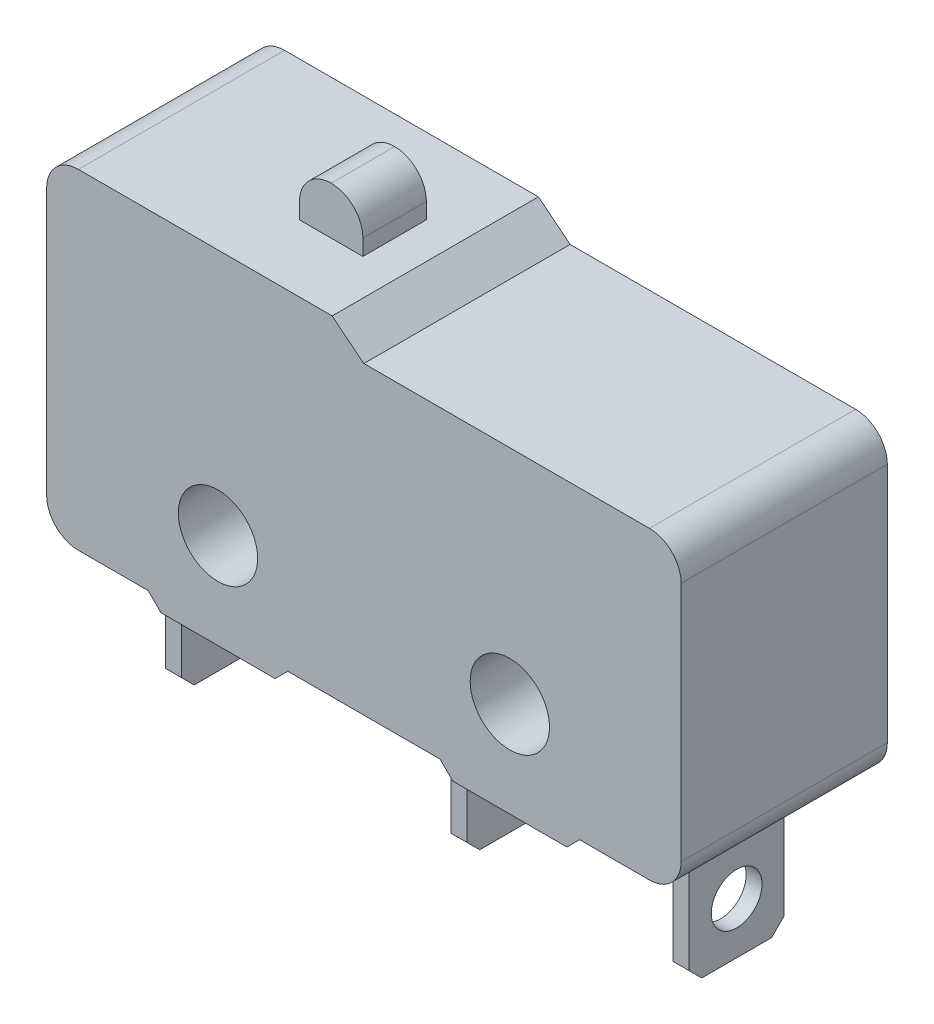
from build123d import *

# Parameters (mm, degrees)
SKETCH2_R           = 1.25
BOSS_EXTRUDE1_DEPTH = 6.5
CHAMFER1_SIZE       = 0.4
SKETCH3_W           = 2
SKETCH3_H           = 2
BOSS_EXTRUDE2_DEPTH = 1.5
FILLET1_R           = 1
BOSS_EXTRUDE3_DEPTH = 4
CHAMFER2_SIZE       = 0.4
SKETCH5_R           = 0.8
CUT_EXTRUDE2_DEPTH  = 18
BOSS_EXTRUDE4_DEPTH = 0.1


with BuildPart() as part:
    # Sketch2 → Boss-Extrude1 (new body)
    with BuildSketch(Plane.XY):
        with BuildLine():
            ThreePointArc((0, 9.8), (0.292893219, 10.507106781), (1, 10.8))
            Line((1, 10.8), (9, 10.8))
            Line((9, 10.8), (10, 10))
            Line((10, 10), (19, 10))
            ThreePointArc((19, 10), (19.707106781, 9.707106781), (20, 9))
            Line((20, 9), (20, 1.4))
            ThreePointArc((20, 1.4), (19.707106781, 0.692893219), (19, 0.4))
            Line((19, 0.4), (16.4, 0.4))
            Line((16.4, 0.4), (16.4, 0))
            Line((16.4, 0), (12.8, 0))
            Line((12.8, 0), (12.8, 0.4))
            Line((12.8, 0.4), (7.2, 0.4))
            Line((7.2, 0.4), (7.2, 0))
            Line((7.2, 0), (3.6, 0))
            Line((3.6, 0), (3.6, 0.4))
            Line((3.6, 0.4), (1, 0.4))
            ThreePointArc((1, 0.4), (0.292893219, 0.692893219), (0, 1.4))
            Line((0, 1.4), (0, 9.8))
        make_face()
        with Locations(Location((14.6, 3, 0), (0, 0, 180))):
            Circle(SKETCH2_R, mode=Mode.SUBTRACT)
        with Locations(Location((5.4, 3, 0), (0, 0, 180))):
            Circle(SKETCH2_R, mode=Mode.SUBTRACT)
    extrude(amount=BOSS_EXTRUDE1_DEPTH)

    # Chamfer1
    chamfer1_edges = [part.edges().sort_by_distance(p)[0] for p in [
        (3.6, 0.4, 3.25),
        (7.2, 0.4, 3.25),
        (12.8, 0.4, 3.25),
        (16.4, 0.4, 3.25),
    ]]
    chamfer(chamfer1_edges, length=CHAMFER1_SIZE - 0.0001)  # a hair under: the kernel refuses the full size

    # Sketch3 → Boss-Extrude2 (add)
    with BuildSketch(Plane(origin=(0, 10.8, 0), x_dir=(1, 0, 0), z_dir=(0, 1, 0))):
        with Locations((6.861600277, -3.393126413)):
            Rectangle(SKETCH3_W, SKETCH3_H)
    extrude(amount=BOSS_EXTRUDE2_DEPTH)

    # Fillet1
    fillet1_edges = [part.edges().sort_by_distance(p)[0] for p in [
        (5.861600277, 12.3, 3.393126413),
        (7.861600277, 12.3, 3.393126413),
    ]]
    fillet(fillet1_edges, radius=FILLET1_R - 0.0001)  # a hair under: the kernel refuses the full size

    # Sketch4 → Boss-Extrude3 (add)
    with BuildSketch(Plane.XZ.offset(-0.4)):
        Polygon((2, 3.25), (2, 4.75), (2.5, 4.75), (2.5, 1.75), (2.037861295, 1.75), align=None)
        Polygon((11, 3.25), (11, 4.75), (11.5, 4.75), (11.5, 1.75), (11, 1.75), align=None)
        Polygon((18, 3.25), (18, 4.75), (18.5, 4.75), (18.5, 1.75), (18, 1.75), align=None)
    extrude(amount=BOSS_EXTRUDE3_DEPTH)

    # Chamfer2
    chamfer2_edges = [part.edges().sort_by_distance(p)[0] for p in [
        (2.268930648, -3.6, 1.75),
        (2.25, -3.6, 4.75),
        (11.25, -3.6, 1.75),
        (11.25, -3.6, 4.75),
        (18.25, -3.6, 1.75),
        (18.25, -3.6, 4.75),
    ]]
    chamfer(chamfer2_edges, length=CHAMFER2_SIZE)

    # Sketch5 → Cut-Extrude2 (cut)
    with BuildSketch(Plane(origin=(18.5, 0, 0), x_dir=(0, 0, -1), z_dir=(1, 0, 0))):
        with Locations(Location((-3.25, -1.983091363, 0), (0, 0, 90))):
            Circle(SKETCH5_R)
    extrude(amount=-CUT_EXTRUDE2_DEPTH, mode=Mode.SUBTRACT)

    # Sketch6 → Boss-Extrude4 (add)
    # profile 1 of 8: a face of its own
    with BuildSketch(Plane(origin=(0, 0, 0), x_dir=(-1, 0, 0), z_dir=(0, 0, -1))):
        with BuildLine():
            Line((-15.857970631, 8.152098297), (-15.857970631, 7.93500428))
            Line((-15.857970631, 7.93500428), (-16.577942586, 7.93500428))
            Line((-16.577942586, 7.93500428), (-16.692001747, 7.37827685))
            add(Edge.make_bspline(
                [(-16.692001747, 7.37827685), (-16.669591766, 7.384463728), (-16.626175972, 7.396449827), (-16.562095485, 7.409758079), (-16.501261152, 7.417780514), (-16.461785095, 7.418875926), (-16.442682837, 7.41940599)],
                knots=[0, 0, 0, 0, 1.100273476, 2.13160584, 3.095893838, 4, 4, 4, 4], degree=3))
            add(Edge.make_bspline(
                [(-16.442682837, 7.41940599), (-16.41904648, 7.4188944), (-16.372571497, 7.417888487), (-16.304572705, 7.408229321), (-16.23966186, 7.393025658), (-16.177974713, 7.371786105), (-16.119397141, 7.344626409), (-16.064468092, 7.310699302), (-16.012363069, 7.27106724), (-15.964016833, 7.225501447), (-15.920156895, 7.175353612), (-15.881593653, 7.121434328), (-15.848838182, 7.064267599), (-15.822494297, 7.003307231), (-15.801458057, 6.939227171), (-15.787456612, 6.871353181), (-15.778133174, 6.800325032), (-15.77709154, 6.751759888), (-15.776560374, 6.726994799)],
                knots=[0, 0, 0, 0, 1.052922333, 2.070308379, 3.05430497, 4.020497103, 4.973039431, 5.925935799, 6.892292201, 7.88610001, 8.88166317, 9.857072816, 10.836096531, 11.812156883, 12.81219415, 13.836441305, 14.89672472, 16, 16, 16, 16], degree=3))
            add(Edge.make_bspline(
                [(-15.776560374, 6.726994799), (-15.776962587, 6.709745646), (-15.777761575, 6.675480449), (-15.781824721, 6.624593242), (-15.78964775, 6.574783338), (-15.800151087, 6.52604413), (-15.813783883, 6.47846789), (-15.830287263, 6.431918442), (-15.850483908, 6.386685514), (-15.872637169, 6.342341108), (-15.897581467, 6.299887725), (-15.925266565, 6.260185719), (-15.954516171, 6.222639511), (-15.985988819, 6.187651777), (-16.01997704, 6.155452428), (-16.05606921, 6.125850372), (-16.093977331, 6.098344996), (-16.134287882, 6.074052802), (-16.176102622, 6.051699014), (-16.2200254, 6.033360494), (-16.265056396, 6.016965079), (-16.311843725, 6.00389646), (-16.360281412, 5.993656296), (-16.4104493, 5.986701171), (-16.462084276, 5.981635421), (-16.497084879, 5.98131831), (-16.514764835, 5.981158127)],
                knots=[0, 0, 0, 0, 1.056347294, 2.098418968, 3.122841568, 4.141288669, 5.149314143, 6.15115421, 7.162517403, 8.180376062, 9.185164535, 10.17417709, 11.141909838, 12.097768115, 13.052685741, 14.0056014, 14.954263652, 15.917497458, 16.885230207, 17.854509472, 18.828990115, 19.81800267, 20.826176721, 21.857883937, 22.917946725, 24, 24, 24, 24], degree=3))
            add(Edge.make_bspline(
                [(-16.514764835, 5.981158127), (-16.535855411, 5.981575919), (-16.577348627, 5.982397876), (-16.638139637, 5.990996675), (-16.696628946, 6.003311995), (-16.752345722, 6.021839644), (-16.805789295, 6.045054818), (-16.856240177, 6.07439555), (-16.90498748, 6.107644818), (-16.950049521, 6.146881983), (-16.991872504, 6.189769086), (-17.029311202, 6.236310136), (-17.062653889, 6.285736989), (-17.091366622, 6.338289682), (-17.115858282, 6.393830127), (-17.135098775, 6.452566418), (-17.150628066, 6.514191659), (-17.157197849, 6.556617829), (-17.160534733, 6.578166674)],
                knots=[0, 0, 0, 0, 1.0467383, 2.05933395, 3.04377827, 4.011590433, 4.970194871, 5.932262533, 6.905835911, 7.896367577, 8.894135286, 9.877477877, 10.858688626, 11.851381753, 12.8477658, 13.868841284, 14.917554742, 16, 16, 16, 16], degree=3))
            Line((-17.160534733, 6.578166674), (-16.970577468, 6.578166674))
            add(Edge.make_bspline(
                [(-16.970577468, 6.578166674), (-16.965903531, 6.557981867), (-16.956919965, 6.519185547), (-16.93720125, 6.464677545), (-16.913091887, 6.416103538), (-16.884423543, 6.372820981), (-16.850224239, 6.335078397), (-16.811199299, 6.301443317), (-16.767446152, 6.27109931), (-16.718827389, 6.245806493), (-16.66753567, 6.22423539), (-16.613852643, 6.20987127), (-16.559240014, 6.199771206), (-16.522302143, 6.198760189), (-16.503740529, 6.198252144)],
                knots=[0, 0, 0, 0, 1.136247022, 2.183929868, 3.172523383, 4.106158343, 5.02341133, 5.958108904, 6.928429099, 7.938127109, 8.96079061, 9.975095812, 10.982467395, 12, 12, 12, 12], degree=3))
            add(Edge.make_bspline(
                [(-16.503740529, 6.198252144), (-16.485622803, 6.198748519), (-16.449948853, 6.199725886), (-16.397448633, 6.207248526), (-16.3467618, 6.218834296), (-16.298388494, 6.236172732), (-16.251482229, 6.25724549), (-16.20722952, 6.284287464), (-16.164350161, 6.315408523), (-16.124176957, 6.351063247), (-16.087383576, 6.390354443), (-16.054873921, 6.432371724), (-16.02779455, 6.477194769), (-16.004974398, 6.524047581), (-15.987645975, 6.573443661), (-15.975284048, 6.625151514), (-15.968025055, 6.679298859), (-15.967026485, 6.716231252), (-15.966517639, 6.735051022)],
                knots=[0, 0, 0, 0, 1.027316725, 2.022795036, 3.002884548, 3.971462791, 4.93288096, 5.914575861, 6.907176829, 7.935150275, 8.956128384, 9.956726525, 10.942570165, 11.921478529, 12.907843606, 13.90538589, 14.932640048, 16, 16, 16, 16], degree=3))
            add(Edge.make_bspline(
                [(-15.966517639, 6.735051022), (-15.966915863, 6.752030167), (-15.967695328, 6.785264427), (-15.974063816, 6.833886805), (-15.985141223, 6.879892883), (-16.000516617, 6.923504824), (-16.020038034, 6.964763763), (-16.043893661, 7.00371228), (-16.072531192, 7.039837027), (-16.105243905, 7.073154905), (-16.141080911, 7.103903948), (-16.180658793, 7.1301168), (-16.223149321, 7.152168789), (-16.268040554, 7.171199435), (-16.316400279, 7.184867505), (-16.367270814, 7.195129036), (-16.421201489, 7.201064993), (-16.458074239, 7.201888612), (-16.477027789, 7.202311973)],
                knots=[0, 0, 0, 0, 1.045622112, 2.046656509, 3.013763289, 3.955457236, 4.890082067, 5.820317437, 6.762574623, 7.722996705, 8.69280354, 9.665887285, 10.63943826, 11.638615906, 12.663482002, 13.728887084, 14.832589034, 16, 16, 16, 16], degree=3))
            add(Edge.make_bspline(
                [(-16.477027789, 7.202311973), (-16.493434332, 7.201960853), (-16.52730968, 7.201235881), (-16.579272532, 7.195897952), (-16.633877527, 7.187286569), (-16.69091534, 7.175441553), (-16.750557267, 7.159940854), (-16.812677442, 7.141365894), (-16.87740648, 7.119157828), (-16.921020532, 7.102386442), (-16.943440716, 7.093764964)],
                knots=[0, 0, 0, 0, 0.817624296, 1.688186739, 2.600797293, 3.572016777, 4.590301741, 5.671205678, 6.80286297, 8, 8, 8, 8], degree=3))
            Line((-16.943440716, 7.093764964), (-16.726346699, 8.152098297))
            Line((-16.726346699, 8.152098297), (-15.857970631, 8.152098297))
        make_face()
    # profile 2 of 8: a face of its own
    with BuildSketch(Plane(origin=(0, 0, 0), x_dir=(-1, 0, 0), z_dir=(0, 0, -1))):
        Polygon((-14.501133024, 8.152098297), (-13.524209947, 6.035431631), (-13.73070367, 6.035431631), (-14.043624343, 6.713850434), (-15.003162938, 6.713850434), (-15.324987858, 6.035431631), (-15.532329605, 6.035431631), (-14.528269776, 8.152098297), align=None)
        Polygon((-14.516821459, 7.739534863), (-14.900128083, 6.930944451), (-14.143691117, 6.930944451), align=None, mode=Mode.SUBTRACT)
    # profile 3 of 8: a face of its own
    with BuildSketch(Plane(origin=(0, 0, 0), x_dir=(-1, 0, 0), z_dir=(0, 0, -1))):
        with BuildLine():
            Line((-13.062885161, 7.500816246), (-13.252842426, 7.500816246))
            add(Edge.make_bspline(
                [(-13.252842426, 7.500816246), (-13.251604385, 7.526017212), (-13.249172908, 7.575511237), (-13.237786276, 7.64767379), (-13.221493459, 7.716649787), (-13.198457199, 7.781885402), (-13.169848164, 7.843957443), (-13.135540005, 7.902619357), (-13.094903724, 7.957647361), (-13.048816794, 8.008531329), (-12.998761474, 8.055211431), (-12.944752644, 8.095521982), (-12.887998747, 8.129580765), (-12.828671968, 8.158053706), (-12.76610296, 8.179425899), (-12.700859517, 8.195283747), (-12.632654992, 8.20482468), (-12.586185074, 8.205850227), (-12.562551293, 8.206371802)],
                knots=[0, 0, 0, 0, 1.10065271, 2.161652631, 3.183658789, 4.190468796, 5.17591951, 6.163126047, 7.15150782, 8.156236427, 9.156009102, 10.134482811, 11.092018607, 12.041330605, 13.001268258, 13.972401359, 14.968799086, 16, 16, 16, 16], degree=3))
            add(Edge.make_bspline(
                [(-12.562551293, 8.206371802), (-12.539341696, 8.205828449), (-12.493735667, 8.204760782), (-12.427174353, 8.195591969), (-12.363809037, 8.18123154), (-12.303763578, 8.161083645), (-12.247517053, 8.133999729), (-12.194646926, 8.101465027), (-12.144523769, 8.063836844), (-12.099404429, 8.019535728), (-12.057973352, 7.972241905), (-12.02223056, 7.921751601), (-11.991621647, 7.869603414), (-11.966108145, 7.815399692), (-11.947326575, 7.75863007), (-11.933067373, 7.700121048), (-11.925007461, 7.639266995), (-11.923770467, 7.598078745), (-11.923141571, 7.577138362)],
                knots=[0, 0, 0, 0, 1.111607364, 2.184268762, 3.212621178, 4.221274766, 5.211760367, 6.196651075, 7.1921475, 8.207485113, 9.220403448, 10.201281604, 11.166441695, 12.114753415, 13.065576456, 14.026450734, 14.996634279, 16, 16, 16, 16], degree=3))
            add(Edge.make_bspline(
                [(-11.923141571, 7.577138362), (-11.924165592, 7.547657528), (-11.926195663, 7.489213209), (-11.943561025, 7.40332803), (-11.970682486, 7.320116771), (-12.00333803, 7.25314707), (-12.036280889, 7.199182052), (-12.065967144, 7.154750978), (-12.100719673, 7.106911004), (-12.141044288, 7.055822329), (-12.186106834, 7.001084782), (-12.236315476, 6.942731429), (-12.292028249, 6.881365168), (-12.331131247, 6.839451781), (-12.351393441, 6.817733313)],
                knots=[0, 0, 0, 0, 1.184426356, 2.348067706, 3.509069118, 4.696110526, 5.333549288, 6.050745305, 6.844228056, 7.710549037, 8.667450064, 9.695053472, 10.805634456, 12, 12, 12, 12], degree=3))
            Line((-12.351393441, 6.817733313), (-12.880984119, 6.252525648))
            Line((-12.880984119, 6.252525648), (-11.896004819, 6.252525648))
            Line((-11.896004819, 6.252525648), (-11.896004819, 6.035431631))
            Line((-11.896004819, 6.035431631), (-13.334252682, 6.035431631))
            Line((-13.334252682, 6.035431631), (-12.51336593, 6.911439911))
            add(Edge.make_bspline(
                [(-12.51336593, 6.911439911), (-12.493379827, 6.932303172), (-12.454990613, 6.972377228), (-12.400693531, 7.030883685), (-12.351926143, 7.085160788), (-12.308372767, 7.135105986), (-12.270978219, 7.181449839), (-12.237793583, 7.222691398), (-12.211204869, 7.260642899), (-12.182348415, 7.304633651), (-12.15439996, 7.358343957), (-12.13038344, 7.423980998), (-12.115739222, 7.491549384), (-12.113982488, 7.53721014), (-12.113098836, 7.560177891)],
                knots=[0, 0, 0, 0, 1.329631726, 2.553950428, 3.673215718, 4.687767853, 5.603093632, 6.413772471, 7.123043292, 7.734684054, 8.834405432, 9.900288307, 10.943827018, 12, 12, 12, 12], degree=3))
            add(Edge.make_bspline(
                [(-12.113098836, 7.560177891), (-12.113483309, 7.574620451), (-12.114241031, 7.603083964), (-12.120928305, 7.644816018), (-12.131034182, 7.685071882), (-12.145515362, 7.72397538), (-12.164629914, 7.761135369), (-12.187897149, 7.796597084), (-12.214742568, 7.83088041), (-12.24579786, 7.8630255), (-12.279913398, 7.892466039), (-12.31595373, 7.918545843), (-12.354084031, 7.940340924), (-12.394143533, 7.958207706), (-12.436020555, 7.972223293), (-12.479796092, 7.98193491), (-12.525349187, 7.988032413), (-12.556454206, 7.988857412), (-12.572303563, 7.989277785)],
                knots=[0, 0, 0, 0, 0.991446411, 1.95395049, 2.89581595, 3.838931463, 4.798493298, 5.75982156, 6.748411868, 7.785213223, 8.824556874, 9.840280684, 10.836137867, 11.835679398, 12.848801643, 13.863922112, 14.911575587, 16, 16, 16, 16], degree=3))
            add(Edge.make_bspline(
                [(-12.572303563, 7.989277785), (-12.5888564, 7.98884536), (-12.621363439, 7.98799615), (-12.669090664, 7.982055777), (-12.714620634, 7.971807579), (-12.75806788, 7.957791209), (-12.799505915, 7.939975801), (-12.838733218, 7.917786032), (-12.875661727, 7.891307443), (-12.910360863, 7.861286725), (-12.942330984, 7.827862986), (-12.970420285, 7.790603627), (-12.99496395, 7.750188952), (-13.016378106, 7.70672801), (-13.033768452, 7.659826438), (-13.047056976, 7.609650731), (-13.057571879, 7.556418752), (-13.061084651, 7.519658249), (-13.062885161, 7.500816246)],
                knots=[0, 0, 0, 0, 1.031018746, 2.02475058, 2.990194455, 3.934040569, 4.864654155, 5.795059489, 6.735614925, 7.690564532, 8.649604399, 9.611025574, 10.590972636, 11.591080095, 12.624614302, 13.701020113, 14.821632451, 16, 16, 16, 16], degree=3))
        make_face()
    # profile 4 of 8: a face of its own
    with BuildSketch(Plane(origin=(0, 0, 0), x_dir=(-1, 0, 0), z_dir=(0, 0, -1))):
        with BuildLine():
            Line((-10.376346699, 8.152098297), (-10.376346699, 7.93500428))
            Line((-10.376346699, 7.93500428), (-11.096318654, 7.93500428))
            Line((-11.096318654, 7.93500428), (-11.210377816, 7.37827685))
            add(Edge.make_bspline(
                [(-11.210377816, 7.37827685), (-11.187967834, 7.384463728), (-11.14455204, 7.396449827), (-11.080471553, 7.409758079), (-11.01963722, 7.417780514), (-10.980161163, 7.418875926), (-10.961058905, 7.41940599)],
                knots=[0, 0, 0, 0, 1.100273476, 2.13160584, 3.095893838, 4, 4, 4, 4], degree=3))
            add(Edge.make_bspline(
                [(-10.961058905, 7.41940599), (-10.937422548, 7.4188944), (-10.890947565, 7.417888487), (-10.822948774, 7.408229321), (-10.758037929, 7.393025658), (-10.696350781, 7.371786105), (-10.63777321, 7.344626409), (-10.582844161, 7.310699302), (-10.530739137, 7.27106724), (-10.482392902, 7.225501447), (-10.438532963, 7.175353612), (-10.399969722, 7.121434328), (-10.36721425, 7.064267599), (-10.340870365, 7.003307231), (-10.319834125, 6.939227171), (-10.305832681, 6.871353181), (-10.296509242, 6.800325032), (-10.295467609, 6.751759888), (-10.294936443, 6.726994799)],
                knots=[0, 0, 0, 0, 1.052922333, 2.070308379, 3.05430497, 4.020497103, 4.973039431, 5.925935799, 6.892292201, 7.88610001, 8.88166317, 9.857072816, 10.836096531, 11.812156883, 12.81219415, 13.836441305, 14.89672472, 16, 16, 16, 16], degree=3))
            add(Edge.make_bspline(
                [(-10.294936443, 6.726994799), (-10.295338655, 6.709745646), (-10.296137644, 6.675480449), (-10.30020079, 6.624593242), (-10.308023818, 6.574783338), (-10.318527156, 6.52604413), (-10.332159951, 6.47846789), (-10.348663332, 6.431918442), (-10.368859977, 6.386685514), (-10.391013237, 6.342341108), (-10.415957536, 6.299887725), (-10.443642633, 6.260185719), (-10.47289224, 6.222639511), (-10.504364887, 6.187651777), (-10.538353108, 6.155452428), (-10.574445278, 6.125850372), (-10.612353399, 6.098344996), (-10.65266395, 6.074052802), (-10.69447869, 6.051699014), (-10.738401469, 6.033360494), (-10.783432464, 6.016965079), (-10.830219793, 6.00389646), (-10.87865748, 5.993656296), (-10.928825368, 5.986701171), (-10.980460345, 5.981635421), (-11.015460948, 5.98131831), (-11.033140903, 5.981158127)],
                knots=[0, 0, 0, 0, 1.056347294, 2.098418968, 3.122841568, 4.141288669, 5.149314143, 6.15115421, 7.162517403, 8.180376062, 9.185164535, 10.17417709, 11.141909838, 12.097768115, 13.052685741, 14.0056014, 14.954263652, 15.917497458, 16.885230207, 17.854509472, 18.828990115, 19.81800267, 20.826176721, 21.857883937, 22.917946725, 24, 24, 24, 24], degree=3))
            add(Edge.make_bspline(
                [(-11.033140903, 5.981158127), (-11.054231479, 5.981575919), (-11.095724696, 5.982397876), (-11.156515705, 5.990996675), (-11.215005015, 6.003311995), (-11.27072179, 6.021839644), (-11.324165364, 6.045054818), (-11.374616246, 6.07439555), (-11.423363548, 6.107644818), (-11.468425589, 6.146881983), (-11.510248572, 6.189769086), (-11.547687271, 6.236310136), (-11.581029957, 6.285736989), (-11.60974269, 6.338289682), (-11.634234351, 6.393830127), (-11.653474844, 6.452566418), (-11.669004134, 6.514191659), (-11.675573917, 6.556617829), (-11.678910802, 6.578166674)],
                knots=[0, 0, 0, 0, 1.0467383, 2.05933395, 3.04377827, 4.011590433, 4.970194871, 5.932262533, 6.905835911, 7.896367577, 8.894135286, 9.877477877, 10.858688626, 11.851381753, 12.8477658, 13.868841284, 14.917554742, 16, 16, 16, 16], degree=3))
            Line((-11.678910802, 6.578166674), (-11.488953537, 6.578166674))
            add(Edge.make_bspline(
                [(-11.488953537, 6.578166674), (-11.4842796, 6.557981867), (-11.475296033, 6.519185547), (-11.455577318, 6.464677545), (-11.431467956, 6.416103538), (-11.402799612, 6.372820981), (-11.368600307, 6.335078397), (-11.329575367, 6.301443317), (-11.28582222, 6.27109931), (-11.237203458, 6.245806493), (-11.185911738, 6.22423539), (-11.132228711, 6.20987127), (-11.077616083, 6.199771206), (-11.040678211, 6.198760189), (-11.022116598, 6.198252144)],
                knots=[0, 0, 0, 0, 1.136247022, 2.183929868, 3.172523383, 4.106158343, 5.02341133, 5.958108904, 6.928429099, 7.938127109, 8.96079061, 9.975095812, 10.982467395, 12, 12, 12, 12], degree=3))
            add(Edge.make_bspline(
                [(-11.022116598, 6.198252144), (-11.003998872, 6.198748519), (-10.968324921, 6.199725886), (-10.915824702, 6.207248526), (-10.865137868, 6.218834296), (-10.816764562, 6.236172732), (-10.769858298, 6.25724549), (-10.725605589, 6.284287464), (-10.68272623, 6.315408523), (-10.642553025, 6.351063247), (-10.605759644, 6.390354443), (-10.57324999, 6.432371724), (-10.546170618, 6.477194769), (-10.523350467, 6.524047581), (-10.506022043, 6.573443661), (-10.493660116, 6.625151514), (-10.486401124, 6.679298859), (-10.485402553, 6.716231252), (-10.484893708, 6.735051022)],
                knots=[0, 0, 0, 0, 1.027316725, 2.022795036, 3.002884548, 3.971462791, 4.93288096, 5.914575861, 6.907176829, 7.935150275, 8.956128384, 9.956726525, 10.942570165, 11.921478529, 12.907843606, 13.90538589, 14.932640048, 16, 16, 16, 16], degree=3))
            add(Edge.make_bspline(
                [(-10.484893708, 6.735051022), (-10.485291931, 6.752030167), (-10.486071396, 6.785264427), (-10.492439884, 6.833886805), (-10.503517291, 6.879892883), (-10.518892685, 6.923504824), (-10.538414102, 6.964763763), (-10.562269729, 7.00371228), (-10.59090726, 7.039837027), (-10.623619974, 7.073154905), (-10.659456979, 7.103903948), (-10.699034862, 7.1301168), (-10.741525389, 7.152168789), (-10.786416623, 7.171199435), (-10.834776347, 7.184867505), (-10.885646882, 7.195129036), (-10.939577558, 7.201064993), (-10.976450307, 7.201888612), (-10.995403857, 7.202311973)],
                knots=[0, 0, 0, 0, 1.045622112, 2.046656509, 3.013763289, 3.955457236, 4.890082067, 5.820317437, 6.762574623, 7.722996705, 8.69280354, 9.665887285, 10.63943826, 11.638615906, 12.663482002, 13.728887084, 14.832589034, 16, 16, 16, 16], degree=3))
            add(Edge.make_bspline(
                [(-10.995403857, 7.202311973), (-11.0118104, 7.201960853), (-11.045685748, 7.201235881), (-11.097648601, 7.195897952), (-11.152253595, 7.187286569), (-11.209291409, 7.175441553), (-11.268933335, 7.159940854), (-11.331053511, 7.141365894), (-11.395782548, 7.119157828), (-11.439396601, 7.102386442), (-11.461816785, 7.093764964)],
                knots=[0, 0, 0, 0, 0.817624296, 1.688186739, 2.600797293, 3.572016777, 4.590301741, 5.671205678, 6.80286297, 8, 8, 8, 8], degree=3))
            Line((-11.461816785, 7.093764964), (-11.244722768, 8.152098297))
            Line((-11.244722768, 8.152098297), (-10.376346699, 8.152098297))
        make_face()
    # profile 5 of 8: a face of its own
    with BuildSketch(Plane(origin=(0, 0, 0), x_dir=(-1, 0, 0), z_dir=(0, 0, -1))):
        with BuildLine():
            add(Edge.make_bspline(
                [(-10.077842426, 7.092916941), (-10.077644053, 7.126842504), (-10.077258711, 7.192743399), (-10.072971904, 7.288770301), (-10.065850625, 7.37885581), (-10.056091357, 7.463004235), (-10.044215055, 7.541237302), (-10.028360927, 7.613345941), (-10.01033128, 7.679663894), (-9.989435277, 7.740407418), (-9.965856947, 7.796394886), (-9.940194323, 7.848661556), (-9.911428947, 7.897128343), (-9.881204814, 7.942568817), (-9.848298466, 7.984239146), (-9.81364634, 8.022727804), (-9.775895968, 8.057145258), (-9.736330624, 8.088499927), (-9.694592096, 8.115986036), (-9.651870103, 8.140196311), (-9.607870586, 8.160879088), (-9.562473418, 8.177141399), (-9.516086633, 8.190573673), (-9.468548074, 8.19975937), (-9.419779249, 8.205539024), (-9.386861191, 8.206091575), (-9.370166811, 8.206371802)],
                knots=[0, 0, 0, 0, 1.646270934, 3.197905019, 4.663502075, 6.030701355, 7.308322542, 8.50163776, 9.611534131, 10.641858119, 11.616356847, 12.558055219, 13.465016945, 14.349605745, 15.204443733, 16.039544428, 16.859896111, 17.680448484, 18.487036065, 19.28249412, 20.06191084, 20.843045899, 21.620316918, 22.403196591, 23.190181807, 24, 24, 24, 24], degree=3))
            add(Edge.make_bspline(
                [(-9.370166811, 8.206371802), (-9.353332974, 8.20607679), (-9.319855769, 8.205490104), (-9.270361828, 8.199851338), (-9.222011306, 8.190494992), (-9.175010336, 8.177238022), (-9.128972845, 8.160791113), (-9.084258922, 8.140176523), (-9.04059083, 8.116180256), (-8.998662513, 8.087983911), (-8.958013674, 8.05654701), (-8.919642763, 8.021009587), (-8.883546287, 7.981730471), (-8.849271222, 7.939129915), (-8.81778998, 7.89239084), (-8.787809856, 7.842326164), (-8.760975339, 7.788060355), (-8.735131036, 7.730498834), (-8.712823191, 7.668048907), (-8.692705034, 7.6010626), (-8.676449657, 7.528748687), (-8.662909478, 7.451486577), (-8.652419946, 7.368992527), (-8.644780205, 7.281443374), (-8.640744578, 7.188781519), (-8.639984573, 7.125427963), (-8.639594562, 7.092916941)],
                knots=[0, 0, 0, 0, 0.810914788, 1.612654377, 2.396697861, 3.181598691, 3.963628158, 4.749916497, 5.551656086, 6.361998678, 7.18212741, 8.025565596, 8.878627764, 9.750805457, 10.657531673, 11.591944965, 12.560506719, 13.57287815, 14.630710178, 15.753379473, 16.941251878, 18.199788006, 19.531962791, 20.947069417, 22.433333509, 24, 24, 24, 24], degree=3))
            add(Edge.make_bspline(
                [(-8.639594562, 7.092916941), (-8.639988616, 7.06054772), (-8.640756413, 6.997477614), (-8.644734964, 6.905232691), (-8.652571851, 6.81814816), (-8.662375034, 6.736015166), (-8.675952521, 6.659175558), (-8.692647074, 6.587363439), (-8.711183222, 6.520268691), (-8.734064264, 6.458440972), (-8.759107884, 6.401017787), (-8.78635555, 6.347395274), (-8.815547302, 6.297099468), (-8.847350972, 6.250532954), (-8.881249941, 6.207365862), (-8.917969746, 6.168360157), (-8.956475291, 6.132575988), (-8.997243752, 6.10073429), (-9.039825976, 6.072863956), (-9.083344084, 6.047939389), (-9.128570225, 6.027841521), (-9.174479487, 6.010584615), (-9.221728547, 5.997400533), (-9.270258507, 5.988284439), (-9.319822516, 5.981890988), (-9.353327272, 5.981403259), (-9.370166811, 5.981158127)],
                knots=[0, 0, 0, 0, 1.561518951, 3.042555995, 4.452378317, 5.7783523, 7.031515105, 8.214008947, 9.334062868, 10.386615937, 11.391082383, 12.354592575, 13.286541444, 14.194233754, 15.072674879, 15.931287219, 16.775624067, 17.606195743, 18.42308326, 19.229000347, 20.022332153, 20.807536673, 21.593273796, 22.3848459, 23.188221202, 24, 24, 24, 24], degree=3))
            add(Edge.make_bspline(
                [(-9.370166811, 5.981158127), (-9.386860728, 5.981440161), (-9.419777873, 5.981996277), (-9.468553387, 5.987749819), (-9.515895627, 5.996999957), (-9.562038207, 6.009951903), (-9.607217861, 6.025805637), (-9.650818949, 6.046460484), (-9.693326262, 6.07024823), (-9.734626394, 6.097338795), (-9.773943272, 6.128376194), (-9.811498143, 6.162705073), (-9.846347559, 6.201182088), (-9.878783417, 6.24319969), (-9.909610604, 6.288371317), (-9.93796751, 6.337313714), (-9.964196551, 6.389832817), (-9.988171424, 6.446267934), (-10.009427996, 6.507442581), (-10.028204467, 6.574056608), (-10.043029696, 6.646697969), (-10.055719388, 6.724783234), (-10.06595461, 6.808647944), (-10.072942226, 6.898337629), (-10.077261021, 6.993796398), (-10.077645088, 7.059273833), (-10.077842426, 7.092916941)],
                knots=[0, 0, 0, 0, 0.810891512, 1.598919785, 2.382837074, 3.152667961, 3.926044502, 4.706494248, 5.493654104, 6.291793342, 7.103789334, 7.925228297, 8.761435821, 9.622817696, 10.50288917, 11.416980706, 12.369136599, 13.353924996, 14.394355917, 15.514179734, 16.714354668, 17.994756427, 19.357759367, 20.818452758, 22.365282078, 24, 24, 24, 24], degree=3))
        make_face()
        with BuildLine():
            add(Edge.make_bspline(
                [(-9.887885161, 7.093764964), (-9.887812924, 7.065493132), (-9.887672726, 7.010623057), (-9.884010166, 6.930889276), (-9.87902074, 6.856521505), (-9.872585289, 6.787425319), (-9.863028268, 6.723834597), (-9.852319877, 6.665311979), (-9.839288413, 6.612167174), (-9.823869998, 6.564035498), (-9.806308258, 6.520100109), (-9.78713376, 6.479217469), (-9.766535132, 6.440904632), (-9.743482122, 6.405505735), (-9.718375393, 6.372905341), (-9.691782041, 6.342526437), (-9.662709574, 6.31543493), (-9.622490644, 6.282942974), (-9.569394681, 6.249367117), (-9.502495643, 6.220129244), (-9.433753295, 6.201755092), (-9.387095158, 6.199418439), (-9.363806635, 6.198252144)],
                knots=[0, 0, 0, 0, 1.459021318, 2.831673884, 4.118529203, 5.306027144, 6.411944654, 7.436330062, 8.375795394, 9.233974572, 10.042671642, 10.816086306, 11.563610507, 12.285937304, 12.993564865, 13.685989202, 14.367179055, 15.041617293, 16.353048772, 17.594441528, 18.799311195, 20, 20, 20, 20], degree=3))
            add(Edge.make_bspline(
                [(-9.363806635, 6.198252144), (-9.340367472, 6.199218421), (-9.293537538, 6.20114898), (-9.225118529, 6.219774883), (-9.158697365, 6.24787789), (-9.106644335, 6.281108048), (-9.067042987, 6.312754228), (-9.038669379, 6.339735468), (-9.012627092, 6.369946873), (-8.987927361, 6.402543114), (-8.965273539, 6.43814695), (-8.944673451, 6.476587174), (-8.925875427, 6.517970534), (-8.915165671, 6.546859852), (-8.909690049, 6.561630215)],
                knots=[0, 0, 0, 0, 1.353760809, 2.704726607, 4.075137775, 5.516104923, 6.260822281, 7.007110065, 7.778089737, 8.566572457, 9.372053459, 10.217411131, 11.088608312, 12, 12, 12, 12], degree=3))
            add(Edge.make_bspline(
                [(-8.909690049, 6.561630215), (-8.903308741, 6.580516772), (-8.890351951, 6.618864582), (-8.873653402, 6.678351171), (-8.860502613, 6.740764271), (-8.848671434, 6.80573089), (-8.840596015, 6.873730137), (-8.834096147, 6.944551617), (-8.830267589, 7.018248727), (-8.829793001, 7.068319983), (-8.829551827, 7.093764964)],
                knots=[0, 0, 0, 0, 0.884706709, 1.796334032, 2.740027952, 3.714592787, 4.726048262, 5.777819803, 6.87074269, 8, 8, 8, 8], degree=3))
            add(Edge.make_bspline(
                [(-8.829551827, 7.093764964), (-8.829884561, 7.119205829), (-8.830535459, 7.1689736), (-8.833023442, 7.241858405), (-8.839448175, 7.311084146), (-8.846583832, 7.376949051), (-8.857105009, 7.43908852), (-8.868449016, 7.498022752), (-8.883689749, 7.553021629), (-8.899969804, 7.604946233), (-8.918602757, 7.653206629), (-8.939113701, 7.698027824), (-8.961019241, 7.739626205), (-8.984811929, 7.777887641), (-9.010209319, 7.812983512), (-9.037881741, 7.844210148), (-9.066731528, 7.872535362), (-9.107140017, 7.904867487), (-9.160041135, 7.937834084), (-9.225866836, 7.968172424), (-9.294368607, 7.985594582), (-9.340677315, 7.988050936), (-9.363806635, 7.989277785)],
                knots=[0, 0, 0, 0, 1.31362396, 2.569729283, 3.763502607, 4.902122613, 5.988968491, 7.01645872, 7.998833611, 8.933434873, 9.825090667, 10.667526885, 11.477055099, 12.250526234, 12.991942729, 13.710640831, 14.402115721, 15.076753259, 16.378508321, 17.609869233, 18.806226677, 20, 20, 20, 20], degree=3))
            add(Edge.make_bspline(
                [(-9.363806635, 7.989277785), (-9.387217326, 7.988049243), (-9.434081358, 7.985589922), (-9.503295121, 7.968237335), (-9.569640134, 7.937991399), (-9.622401361, 7.904758297), (-9.662838032, 7.87310608), (-9.691311851, 7.845658082), (-9.718009775, 7.815633919), (-9.74260405, 7.782733713), (-9.765638998, 7.747376086), (-9.786794182, 7.709282881), (-9.805854662, 7.668261056), (-9.823443882, 7.624345402), (-9.83890933, 7.576217878), (-9.851666155, 7.523138535), (-9.863451182, 7.464802057), (-9.871794035, 7.400866926), (-9.879210688, 7.331753433), (-9.883977027, 7.257200008), (-9.887684978, 7.177332501), (-9.887817097, 7.122178725), (-9.887885161, 7.093764964)],
                knots=[0, 0, 0, 0, 1.207732386, 2.417664972, 3.655092373, 4.956220595, 5.625982001, 6.301752483, 6.994047911, 7.697131622, 8.419323945, 9.170223765, 9.943494443, 10.752040957, 11.610060368, 12.549350801, 13.567764191, 14.679664412, 15.874934091, 17.154273443, 18.533957287, 20, 20, 20, 20], degree=3))
        make_face(mode=Mode.SUBTRACT)
    # profile 6 of 8: a face of its own
    with BuildSketch(Plane(origin=(0, 0, 0), x_dir=(-1, 0, 0), z_dir=(0, 0, -1))):
        Polygon((-8.422500545, 8.152098297), (-8.218974904, 8.152098297), (-7.513419349, 6.484036065), (-6.807863793, 8.152098297), (-6.604338152, 8.152098297), (-7.499850973, 6.035431631), (-7.526987725, 6.035431631), align=None)
    # profile 7 of 8: a face of its own
    with BuildSketch(Plane(origin=(0, 0, 0), x_dir=(-1, 0, 0), z_dir=(0, 0, -1))):
        Polygon((-5.356047554, 8.152098297), (-4.379124477, 6.035431631), (-4.5856182, 6.035431631), (-4.898538873, 6.713850434), (-5.858077468, 6.713850434), (-6.179902388, 6.035431631), (-6.387244135, 6.035431631), (-5.383184306, 8.152098297), align=None)
        Polygon((-5.371735989, 7.739534863), (-5.755042613, 6.930944451), (-4.998605647, 6.930944451), align=None, mode=Mode.SUBTRACT)
    # profile 8 of 8: a face of its own
    with BuildSketch(Plane(origin=(0, 0, 0), x_dir=(-1, 0, 0), z_dir=(0, 0, -1))):
        with BuildLine():
            Line((-2.045363793, 7.763703532), (-2.2115764, 7.636500007))
            add(Edge.make_bspline(
                [(-2.2115764, 7.636500007), (-2.223433294, 7.650630855), (-2.246987227, 7.678702038), (-2.284881125, 7.718120143), (-2.324373071, 7.755050087), (-2.365447968, 7.789667795), (-2.40884515, 7.820762696), (-2.453513347, 7.84995522), (-2.500199784, 7.8761219), (-2.564759167, 7.907849515), (-2.649212865, 7.940957904), (-2.755526887, 7.96871843), (-2.866507408, 7.986390284), (-2.942222147, 7.988304259), (-2.980733718, 7.989277785)],
                knots=[0, 0, 0, 0, 0.757959112, 1.505699292, 2.245454638, 2.979532153, 3.711538275, 4.438200793, 5.171680507, 5.909471876, 7.393775596, 8.890124382, 10.418191784, 12, 12, 12, 12], degree=3))
            add(Edge.make_bspline(
                [(-2.980733718, 7.989277785), (-3.001950761, 7.989033483), (-3.044187933, 7.988547149), (-3.106870581, 7.982131154), (-3.16838276, 7.973113422), (-3.228684456, 7.959732869), (-3.287698912, 7.942816095), (-3.345811936, 7.922601678), (-3.402182156, 7.897591846), (-3.457589376, 7.869949232), (-3.510674899, 7.83872692), (-3.560903428, 7.80467075), (-3.60809177, 7.76816182), (-3.652277255, 7.729063294), (-3.693505052, 7.687551251), (-3.731476426, 7.643183292), (-3.766059984, 7.596101264), (-3.797941232, 7.546926012), (-3.826493695, 7.495800777), (-3.85039986, 7.442536329), (-3.871569624, 7.3880448), (-3.888321071, 7.331710527), (-3.901580183, 7.273929902), (-3.910728818, 7.214547854), (-3.917071846, 7.153688438), (-3.917555762, 7.112438044), (-3.917799691, 7.091644905)],
                knots=[0, 0, 0, 0, 1.054917814, 2.100044995, 3.131103042, 4.146048494, 5.169673617, 6.183595914, 7.203665975, 8.234915748, 9.262203917, 10.264457458, 11.251630812, 12.227803204, 13.197192746, 14.159520551, 15.12972552, 16.100847026, 17.073214652, 18.039054194, 19.002613845, 19.979014051, 20.95965708, 21.949030935, 22.966165397, 24, 24, 24, 24], degree=3))
            add(Edge.make_bspline(
                [(-3.917799691, 7.091644905), (-3.917036591, 7.060359774), (-3.915538345, 6.998935568), (-3.902204352, 6.90896477), (-3.881941749, 6.822773696), (-3.851573281, 6.740901124), (-3.814126998, 6.662337498), (-3.766810057, 6.588412097), (-3.712008628, 6.518007793), (-3.648947431, 6.452788487), (-3.579759152, 6.393211139), (-3.505525891, 6.340747692), (-3.426432536, 6.297014406), (-3.343352383, 6.260622286), (-3.255646115, 6.232647979), (-3.163471448, 6.212954438), (-3.067028861, 6.200107976), (-3.001128319, 6.198878079), (-2.967589354, 6.198252144)],
                knots=[0, 0, 0, 0, 1.029171465, 2.020641659, 2.987623507, 3.938342917, 4.889210282, 5.84687017, 6.821220943, 7.821438502, 8.827599549, 9.822697543, 10.807740252, 11.797342354, 12.80366471, 13.83203677, 14.896651826, 16, 16, 16, 16], degree=3))
            add(Edge.make_bspline(
                [(-2.967589354, 6.198252144), (-2.930636775, 6.199273453), (-2.857905261, 6.201283635), (-2.751244597, 6.218313276), (-2.649139158, 6.245925445), (-2.551583451, 6.284568475), (-2.458852498, 6.334803196), (-2.370801185, 6.395701437), (-2.287355187, 6.467842476), (-2.237177317, 6.522926082), (-2.2115764, 6.551029921)],
                knots=[0, 0, 0, 0, 1.028121516, 2.023589091, 2.998037872, 3.967518031, 4.937445131, 5.927275754, 6.942489185, 8, 8, 8, 8], degree=3))
            Line((-2.2115764, 6.551029921), (-2.045363793, 6.425098431))
            add(Edge.make_bspline(
                [(-2.045363793, 6.425098431), (-2.058739983, 6.407839462), (-2.085428293, 6.373404195), (-2.128643379, 6.324858923), (-2.174168221, 6.279196958), (-2.22234096, 6.236786445), (-2.272607434, 6.196778744), (-2.325870213, 6.160310494), (-2.381429104, 6.126872673), (-2.439095861, 6.096255438), (-2.498809212, 6.069091198), (-2.560497609, 6.045835824), (-2.623895147, 6.025803153), (-2.689004726, 6.00932222), (-2.755961398, 5.996458279), (-2.824523542, 5.987858761), (-2.894839133, 5.981967222), (-2.942277516, 5.981430244), (-2.966317319, 5.981158127)],
                knots=[0, 0, 0, 0, 0.986787822, 1.968848986, 2.935600012, 3.899624008, 4.868462664, 5.837806735, 6.815139263, 7.798259679, 8.787526145, 9.778297419, 10.776456485, 11.791383307, 12.812564526, 13.85620153, 14.913611965, 16, 16, 16, 16], degree=3))
            add(Edge.make_bspline(
                [(-2.966317319, 5.981158127), (-2.989082775, 5.98131657), (-3.034098644, 5.981629871), (-3.100561223, 5.986705134), (-3.165264445, 5.993629499), (-3.228023386, 6.004055674), (-3.289180523, 6.016359155), (-3.348181448, 6.032851773), (-3.405606742, 6.051326745), (-3.461225691, 6.073040713), (-3.515085604, 6.097543357), (-3.567012767, 6.125236347), (-3.616983295, 6.155886808), (-3.665488478, 6.188819124), (-3.711811778, 6.225091111), (-3.756354625, 6.264199028), (-3.799366789, 6.306011063), (-3.825977936, 6.336161379), (-3.839357516, 6.351320386)],
                knots=[0, 0, 0, 0, 1.114604814, 2.203992996, 3.262667896, 4.300477797, 5.318619304, 6.316056647, 7.298880507, 8.271930387, 9.238335007, 10.195173496, 11.151986948, 12.108099108, 13.064862484, 14.031167946, 15.010108607, 16, 16, 16, 16], degree=3))
            add(Edge.make_bspline(
                [(-3.839357516, 6.351320386), (-3.860787644, 6.377652438), (-3.903389175, 6.42999864), (-3.957893755, 6.514838257), (-4.004549657, 6.60341665), (-4.042272238, 6.696199178), (-4.071762081, 6.792977646), (-4.092191661, 6.893800838), (-4.105467155, 6.998574593), (-4.106985283, 7.069837794), (-4.107756956, 7.106061305)],
                knots=[0, 0, 0, 0, 0.994628077, 1.977248131, 2.950237994, 3.925870899, 4.908910175, 5.911660606, 6.938484602, 8, 8, 8, 8], degree=3))
            add(Edge.make_bspline(
                [(-4.107756956, 7.106061305), (-4.106816434, 7.144134365), (-4.104966016, 7.219040734), (-4.089244749, 7.328970696), (-4.063954334, 7.434290828), (-4.028033359, 7.534804521), (-3.982491551, 7.631040452), (-3.926232599, 7.722263466), (-3.859910089, 7.80905696), (-3.784044179, 7.890103976), (-3.700848695, 7.964211108), (-3.611755889, 8.029408193), (-3.51694014, 8.083665929), (-3.417446011, 8.129020751), (-3.312528479, 8.163881926), (-3.202411394, 8.188285996), (-3.08730167, 8.203475872), (-3.008765822, 8.205396116), (-2.968861389, 8.206371802)],
                knots=[0, 0, 0, 0, 1.032925535, 2.032216505, 3.007276963, 3.968222605, 4.92396291, 5.891752235, 6.871517503, 7.883894988, 8.900124299, 9.891468569, 10.874487609, 11.85992873, 12.854644235, 13.869047385, 14.917252991, 16, 16, 16, 16], degree=3))
            add(Edge.make_bspline(
                [(-2.968861389, 8.206371802), (-2.944541209, 8.206080223), (-2.89640186, 8.205503072), (-2.825189542, 8.199875072), (-2.75585823, 8.190493034), (-2.68836016, 8.177722839), (-2.622366959, 8.161873649), (-2.558383003, 8.141226898), (-2.496032845, 8.117619091), (-2.435709715, 8.090429923), (-2.377703039, 8.05990956), (-2.322030885, 8.026396302), (-2.26913547, 7.989931696), (-2.218644595, 7.950825871), (-2.171402887, 7.908251504), (-2.12606904, 7.863379625), (-2.084182579, 7.814917741), (-2.058327075, 7.780806185), (-2.045363793, 7.763703532)],
                knots=[0, 0, 0, 0, 1.096760587, 2.17092713, 3.219439832, 4.250915756, 5.268269357, 6.278326846, 7.281116186, 8.274029601, 9.260640565, 10.235837813, 11.203064059, 12.156899882, 13.114053108, 14.069676657, 15.032185724, 16, 16, 16, 16], degree=3))
        make_face()
    extrude(amount=BOSS_EXTRUDE4_DEPTH)


solid = part.part
